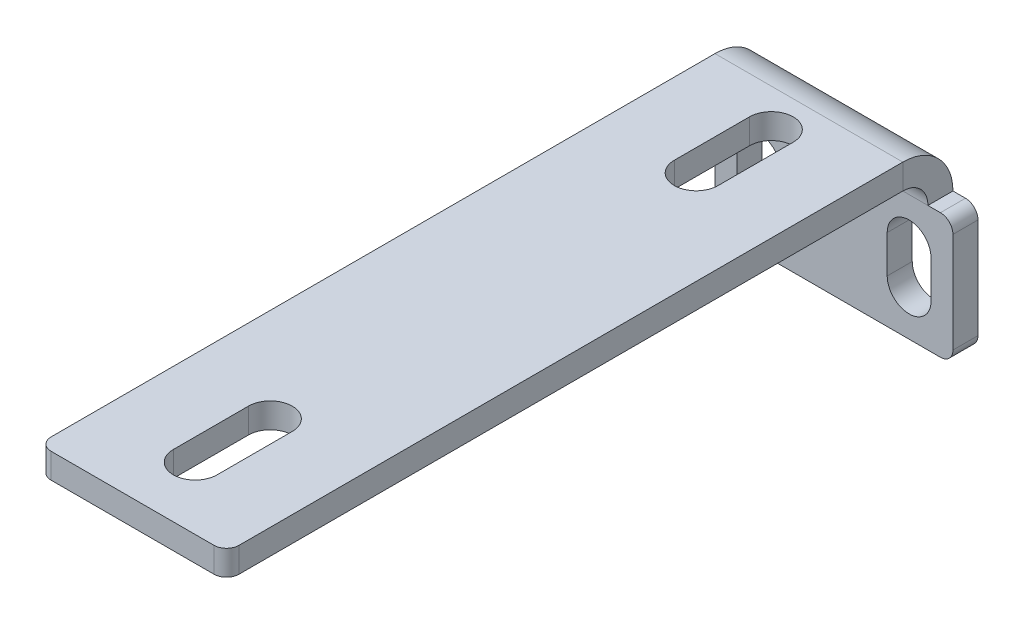
from build123d import *

# Parameters (mm, degrees)
CROQUIS1_W             = 19
CROQUIS1_H             = 10
BRIDA_BASE1_DEPTH      = 2
BRIDA_DE_ARISTA1_DEPTH = 15
CORTAR_EXTRUIR1_REACH  = 62.77
REDONDEO1_R            = 1


# Sheet-metal steps are written as plain solids
with BuildPart() as part:
    # Croquis1 → Brida base1 (new body)
    with BuildSketch(Plane.XY):
        with Locations((9.5, -5)):
            Rectangle(CROQUIS1_W, CROQUIS1_H)
        with BuildLine():
            Line((5.25, -3.5), (5.25, -6.5))
            ThreePointArc((5.25, -6.5), (3.5, -8.25), (1.75, -6.5))
            Line((1.75, -6.5), (1.75, -3.5))
            ThreePointArc((1.75, -3.5), (3.5, -1.75), (5.25, -3.5))
        make_face(mode=Mode.SUBTRACT)
        with BuildLine():
            Line((17.25, -3.5), (17.25, -6.5))
            ThreePointArc((17.25, -6.5), (15.5, -8.25), (13.75, -6.5))
            Line((13.75, -6.5), (13.75, -3.5))
            ThreePointArc((13.75, -3.5), (15.5, -1.75), (17.25, -3.5))
        make_face(mode=Mode.SUBTRACT)
    extrude(amount=-BRIDA_BASE1_DEPTH)

    # Brida de arista1 section (across the edge) → Brida de arista1 (add)
    with BuildSketch(Plane(origin=(17, 2, 0), x_dir=(0, -1, 0), z_dir=(-1, 0, 0))):
        with BuildLine():
            Line((-2, 2), (-2, 56))
            Line((-2, 56), (0, 56))
            Line((0, 56), (0, 2))
            ThreePointArc((0, 2), (0.585786438, 0.585786438), (2, 0))
            Line((2, 0), (2, -2))
            ThreePointArc((2, -2), (-0.828427125, -0.828427125), (-2, 2))
        make_face()
    extrude(amount=BRIDA_DE_ARISTA1_DEPTH)

    # Croquis9 → Cortar-Extruir1 (cut, up to next)
    with BuildSketch(Plane(origin=(0, 4, 0), x_dir=(1, 0, 0), z_dir=(0, 1, 0)), mode=Mode.PRIVATE) as cortar_extruir1_sk1:
        with BuildLine():
            Line((7.75, -11), (7.75, -5))
            ThreePointArc((7.75, -5), (9.5, -3.25), (11.25, -5))
            Line((11.25, -5), (11.25, -11))
            ThreePointArc((11.25, -11), (9.5, -12.75), (7.75, -11))
        make_face()
    cortar_extruir1_tool1 = extrude(cortar_extruir1_sk1.sketch, amount=-CORTAR_EXTRUIR1_REACH, mode=Mode.PRIVATE) & part.part
    # Croquis9 → Cortar-Extruir1 (cut, up to next)
    with BuildSketch(Plane(origin=(0, 4, 0), x_dir=(1, 0, 0), z_dir=(0, 1, 0)), mode=Mode.PRIVATE) as cortar_extruir1_sk2:
        with BuildLine():
            Line((7.75, -51), (7.75, -45))
            ThreePointArc((7.75, -45), (9.5, -43.25), (11.25, -45))
            Line((11.25, -45), (11.25, -51))
            ThreePointArc((11.25, -51), (9.5, -52.75), (7.75, -51))
        make_face()
    cortar_extruir1_tool2 = extrude(cortar_extruir1_sk2.sketch, amount=-CORTAR_EXTRUIR1_REACH, mode=Mode.PRIVATE) & part.part
    add(cortar_extruir1_tool1.solids().sort_by_distance((9.5, 4, 8))[0], mode=Mode.SUBTRACT)
    add(cortar_extruir1_tool2.solids().sort_by_distance((9.5, 4, 48))[0], mode=Mode.SUBTRACT)

    # Redondeo1
    redondeo1_edges = [part.edges().sort_by_distance(p)[0] for p in [
        (17, 3, 56),
        (2, 3, 56),
        (0, 0, -1),
        (19, 0, -1),
        (19, -10, -1),
        (0, -10, -1),
    ]]
    fillet(redondeo1_edges, radius=REDONDEO1_R)


solid = part.part
